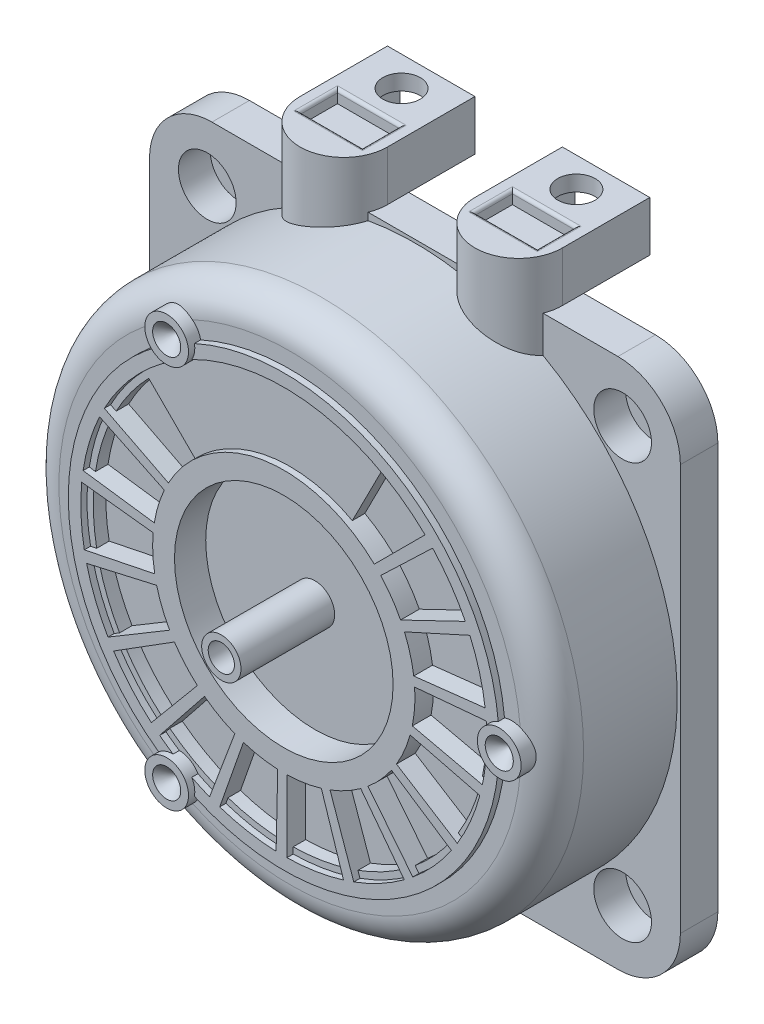
from build123d import *

# Parameters (mm, degrees)
SKETCH_1_W            = 85
SKETCH_1_H            = 85
EXTRUDE_1_DEPTH       = 6
FILLET_1_R            = 10
SKETCH_2_R            = 42
EXTRUDE_2_DEPTH       = 20
FILLET_2_R            = 5
CUT_EXTRUDE_1_DEPTH   = 2
EXTRUDE_START         = 1
SKETCH_4_R            = 34.5
EXTRUDE_3_DEPTH       = 1
SKETCH_5_R            = 17.5
CUT_EXTRUDE_3_DEPTH   = 5
EXTRUDE_5_DEPTH       = 2
EXTRUDE_5_DEPTH_BACK  = 15
SKETCH_7_R            = 3.5
SKETCH_8_R            = 2.25
CUT_EXTRUDE_4_DEPTH   = 2
CHAMFER_1_SIZE        = 2
EXTRUDE_6_DEPTH       = 8
EXTRUDE_7_REACH       = 125.426
EXTRUDE_7_END_RADIUS  = 42
SKETCH_13_W           = 10
SKETCH_13_H           = 5.5
CUT_EXTRUDE_6_DEPTH   = 14
SKETCH_14_W           = 10
SKETCH_14_H           = 6
CUT_EXTRUDE_7_DEPTH   = 2
FILLET_3_R            = 0.5
SKETCH_15_R           = 3
CUT_EXTRUDE_8_DEPTH   = 11
HOLE_WIZARD_M51_D     = 4.2
HOLE_WIZARD_M51_DEPTH = 38.5
HOLE_WIZARD_M51_TIP   = 1.2618073
SKETCH_9_R            = 3.15
EXTRUDE_8_DEPTH       = 15
HOLE_WIZARD_M52_D     = 4.2
HOLE_WIZARD_M52_DEPTH = 14
HOLE_WIZARD_M52_TIP   = 1.2618073
SKETCH_22_R           = 4.618802154
SKETCH_22_R_2         = 4.62
CUT_EXTRUDE_9_DEPTH   = 5.1


with BuildPart() as part:
    # Эскиз1 → Бобышка-Вытянуть1 (new body)
    with BuildSketch(Plane.XY):
        with Locations((42.5, 42.5)):
            Rectangle(SKETCH_1_W, SKETCH_1_H)
    extrude(amount=EXTRUDE_1_DEPTH)

    # Скругление1
    fillet_1_edges = [part.edges().sort_by_distance(p)[0] for p in [
        (0, 85, 3),
        (85, 85, 3),
        (85, 0, 3),
        (0, 0, 3),
    ]]
    fillet(fillet_1_edges, radius=FILLET_1_R)

    # Эскиз2 → Бобышка-Вытянуть2 (add)
    with BuildSketch(Plane.XY.offset(6)):
        with Locations((42.5, 42.5)):
            Circle(SKETCH_2_R)
    extrude(amount=EXTRUDE_2_DEPTH)

    # Скругление2
    fillet_2_edges = [part.edges().sort_by_distance(p)[0] for p in [
        (0.5, 42.5, 26),
    ]]
    fillet(fillet_2_edges, radius=FILLET_2_R)

    # Эскиз3 → Вырез-Вытянуть1 (cut)
    with BuildSketch(Plane.XY.offset(26)):
        with BuildLine():
            Line((61.198040686, 52.059459948), (70.660001971, 56.616100347))
            ThreePointArc((70.660001971, 56.616100347), (68.393065377, 60.438761535), (65.610701121, 63.904333526))
            Line((65.610701121, 63.904333526), (58.019920505, 56.646804146))
            ThreePointArc((58.019920505, 56.646804146), (59.762043584, 54.459174357), (61.198040686, 52.059459948))
        make_face()
        with BuildLine():
            Line((56.991479449, 57.69858623), (64.417504061, 65.124610842))
            ThreePointArc((64.417504061, 65.124610842), (61.015235447, 67.984035323), (57.244402341, 70.336174299))
            Line((57.244402341, 70.336174299), (52.476601049, 60.978837396))
            ThreePointArc((52.476601049, 60.978837396), (54.843490298, 59.489356882), (56.991479449, 57.69858623))
        make_face()
        with BuildLine():
            Line((63.306058378, 45.347443553), (73.742008823, 46.523292771))
            ThreePointArc((73.742008823, 46.523292771), (72.864830112, 50.880160635), (71.383208738, 55.070212925))
            Line((71.383208738, 55.070212925), (61.821387455, 50.727027824))
            ThreePointArc((61.821387455, 50.727027824), (62.743220075, 48.086773757), (63.306058378, 45.347443553))
        make_face()
        with BuildLine():
            Line((63.078942658, 38.31584906), (73.317620695, 35.978937612))
            ThreePointArc((73.317620695, 35.978937612), (73.928648564, 40.381026323), (73.914057387, 44.82529535))
            Line((73.914057387, 44.82529535), (63.45435057, 43.883904697))
            ThreePointArc((63.45435057, 43.883904697), (63.452432376, 41.087350882), (63.078942658, 38.31584906))
        make_face()
        with BuildLine():
            Line((60.542183483, 31.753855799), (69.434468086, 26.166463061))
            ThreePointArc((69.434468086, 26.166463061), (71.465124835, 30.119711503), (72.919201472, 34.319402112))
            Line((72.919201472, 34.319402112), (62.735536945, 36.885461324))
            ThreePointArc((62.735536945, 36.885461324), (61.810083224, 34.246474335), (60.542183483, 31.753855799))
        make_face()
        with BuildLine():
            Line((55.980489805, 26.397938188), (62.528370178, 18.187155905))
            ThreePointArc((62.528370178, 18.187155905), (65.750748421, 21.247877803), (68.510296994, 24.731644694))
            Line((68.510296994, 24.731644694), (59.745621435, 30.517156376))
            ThreePointArc((59.745621435, 30.517156376), (58.000498947, 28.331918535), (55.980489805, 26.397938188))
        make_face()
        with BuildLine():
            Line((49.905835741, 22.849208744), (53.374421403, 12.936560431))
            ThreePointArc((53.374421403, 12.936560431), (57.426862868, 14.761240747), (61.182170026, 17.138089127))
            Line((61.182170026, 17.138089127), (54.820172242, 25.493725983))
            ThreePointArc((54.820172242, 25.493725983), (52.451241912, 24.007493831), (49.905835741, 22.849208744))
        make_face()
        with BuildLine():
            Line((43, 21.505953225), (43, 11.003968504))
            ThreePointArc((43, 11.003968504), (47.427685649, 11.387817271), (51.75728073, 12.390985511))
            Line((51.75728073, 12.390985511), (48.511988976, 22.378966514))
            ThreePointArc((48.511988976, 22.378966514), (45.785123766, 21.758544847), (43, 21.505953225))
        make_face()
        with BuildLine():
            Line((36.03804759, 22.518929682), (32.569461927, 12.606281369))
            ThreePointArc((32.569461927, 12.606281369), (36.875457814, 11.506217959), (41.293415903, 11.023117136))
            Line((41.293415903, 11.023117136), (41.529060111, 21.522457824))
            ThreePointArc((41.529060111, 21.522457824), (38.750305209, 21.837478639), (36.03804759, 22.518929682))
        make_face()
        with BuildLine():
            Line((29.801341677, 25.774448386), (23.253461304, 17.563666103))
            ThreePointArc((23.253461304, 17.563666103), (26.954491131, 15.103154306), (30.964970039, 13.188004439))
            Line((30.964970039, 13.188004439), (34.655103072, 23.020328745))
            ThreePointArc((34.655103072, 23.020328745), (32.136327421, 24.235436204), (29.801341677, 25.774448386))
        make_face()
        with BuildLine():
            Line((24.989848594, 30.9071316), (16.097563991, 25.319738862))
            ThreePointArc((16.097563991, 25.319738862), (18.778248821, 21.774930133), (21.931139107, 18.642674887))
            Line((21.931139107, 18.642674887), (28.661605013, 26.704468221))
            ThreePointArc((28.661605013, 26.704468221), (26.685499214, 28.683286755), (24.989848594, 30.9071316))
        make_face()
        with BuildLine():
            Line((22.143578276, 37.340921148), (11.904900239, 35.004009699))
            ThreePointArc((11.904900239, 35.004009699), (13.264377862, 30.77274976), (15.20582012, 26.774932601))
            Line((15.20582012, 26.774932601), (24.221236234, 32.161392976))
            ThreePointArc((24.221236234, 32.161392976), (23.009585241, 34.681833174), (22.143578276, 37.340921148))
        make_face()
        with BuildLine():
            Line((21.581977146, 44.353731344), (11.146026701, 45.529580561))
            ThreePointArc((11.146026701, 45.529580561), (11.031718404, 41.086757844), (11.543818087, 36.672067142))
            Line((11.543818087, 36.672067142), (21.832354153, 38.778654122))
            ThreePointArc((21.832354153, 38.778654122), (21.521145603, 41.557838563), (21.581977146, 44.353731344))
        make_face()
        with BuildLine():
            Line((23.368075575, 51.15849108), (13.90611429, 55.715131479))
            ThreePointArc((13.90611429, 55.715131479), (12.330849274, 51.559378814), (11.356131725, 47.223290049))
            Line((11.356131725, 47.223290049), (21.763070982, 45.813574342))
            ThreePointArc((21.763070982, 45.813574342), (22.38723285, 48.539585876), (23.368075575, 51.15849108))
        make_face()
        with BuildLine():
            Line((27.30141377, 56.991479449), (19.875389158, 64.417504061))
            ThreePointArc((19.875389158, 64.417504061), (17.015964677, 61.015235447), (14.663825701, 57.244402341))
            Line((14.663825701, 57.244402341), (24.021162604, 52.476601049))
            ThreePointArc((24.021162604, 52.476601049), (25.510643118, 54.843490298), (27.30141377, 56.991479449))
        make_face()
    extrude(amount=-CUT_EXTRUDE_1_DEPTH, mode=Mode.SUBTRACT)

    # Эскиз4 → Бобышка-Вытянуть3 (add)
    with BuildSketch(Plane.XY.offset(26).offset(EXTRUDE_START)):
        with Locations((42.5, 42.5)):
            Circle(SKETCH_4_R)
        with BuildLine():
            Line((13.772710365, 57.698448283), (24.021162604, 52.476601049))
            ThreePointArc((24.021162604, 52.476601049), (39.214876234, 63.241455152), (56.991479449, 57.69858623))
            Line((56.991479449, 57.69858623), (65.124697196, 65.831803977))
            ThreePointArc((65.124697196, 65.831803977), (37.415879886, 74.599871069), (13.772710365, 57.698448283))
        make_face(mode=Mode.SUBTRACT)
        with BuildLine():
            Line((23.368075575, 51.15849108), (13.005035394, 56.149068205))
            ThreePointArc((13.005035394, 56.149068205), (11.373098458, 51.846978142), (10.365060946, 47.357539708))
            Line((10.365060946, 47.357539708), (21.763070982, 45.813574342))
            ThreePointArc((21.763070982, 45.813574342), (22.38723285, 48.539585876), (23.368075575, 51.15849108))
        make_face(mode=Mode.SUBTRACT)
        with BuildLine():
            Line((61.198040686, 52.059459948), (71.561080867, 57.050037073))
            ThreePointArc((71.561080867, 57.050037073), (69.215067452, 61.008246028), (66.333584254, 64.59548057))
            Line((66.333584254, 64.59548057), (58.019920505, 56.646804146))
            ThreePointArc((58.019920505, 56.646804146), (59.762043584, 54.459174357), (61.198040686, 52.059459948))
        make_face(mode=Mode.SUBTRACT)
        with BuildLine():
            Line((60.542183483, 31.753855799), (70.281295689, 25.634366011))
            ThreePointArc((70.281295689, 25.634366011), (72.384652608, 29.726686471), (73.889009413, 34.075031867))
            Line((73.889009413, 34.075031867), (62.735536945, 36.885461324))
            ThreePointArc((62.735536945, 36.885461324), (61.810083224, 34.246474335), (60.542183483, 31.753855799))
        make_face(mode=Mode.SUBTRACT)
        with BuildLine():
            Line((63.306058378, 45.347443553), (74.735842387, 46.63527092))
            ThreePointArc((74.735842387, 46.63527092), (73.828792973, 51.146197481), (72.293797475, 55.483821934))
            Line((72.293797475, 55.483821934), (61.821387455, 50.727027824))
            ThreePointArc((61.821387455, 50.727027824), (62.743220075, 48.086773757), (63.306058378, 45.347443553))
        make_face(mode=Mode.SUBTRACT)
        with BuildLine():
            Line((63.078942658, 38.31584906), (74.292667668, 35.756389503))
            ThreePointArc((74.292667668, 35.756389503), (74.926383439, 40.313757318), (74.910153312, 44.914945605))
            Line((74.910153312, 44.914945605), (63.45435057, 43.883904697))
            ThreePointArc((63.45435057, 43.883904697), (63.452432376, 41.087350882), (63.078942658, 38.31584906))
        make_face(mode=Mode.SUBTRACT)
        with BuildLine():
            Line((55.980489805, 26.397938188), (63.151936122, 17.405228943))
            ThreePointArc((63.151936122, 17.405228943), (66.488867418, 20.573207257), (69.344972168, 24.180680436))
            Line((69.344972168, 24.180680436), (59.745621435, 30.517156376))
            ThreePointArc((59.745621435, 30.517156376), (58.000498947, 28.331918535), (55.980489805, 26.397938188))
        make_face(mode=Mode.SUBTRACT)
        with BuildLine():
            Line((43, 21.505953225), (43, 10.003846381))
            ThreePointArc((43, 10.003846381), (47.584120114, 10.400128931), (52.066335462, 11.439812849))
            Line((52.066335462, 11.439812849), (48.511988976, 22.378966514))
            ThreePointArc((48.511988976, 22.378966514), (45.785123766, 21.758544847), (43, 21.505953225))
        make_face(mode=Mode.SUBTRACT)
        with BuildLine():
            Line((49.905835741, 22.849208744), (53.704740799, 11.992561831))
            ThreePointArc((53.704740799, 11.992561831), (57.90073153, 13.880645215), (61.788034051, 16.342367415))
            Line((61.788034051, 16.342367415), (54.820172242, 25.493725983))
            ThreePointArc((54.820172242, 25.493725983), (52.451241912, 24.007493831), (49.905835741, 22.849208744))
        make_face(mode=Mode.SUBTRACT)
        with BuildLine():
            Line((36.03804759, 22.518929682), (32.239142531, 11.662282769))
            ThreePointArc((32.239142531, 11.662282769), (36.696900919, 10.522288371), (41.270975098, 10.02324681))
            Line((41.270975098, 10.02324681), (41.529060111, 21.522457824))
            ThreePointArc((41.529060111, 21.522457824), (38.750305209, 21.837478639), (36.03804759, 22.518929682))
        make_face(mode=Mode.SUBTRACT)
        with BuildLine():
            Line((29.801341677, 25.774448386), (22.62989536, 16.781739141))
            ThreePointArc((22.62989536, 16.781739141), (26.460982913, 14.233413172), (30.613552304, 12.251655233))
            Line((30.613552304, 12.251655233), (34.655103072, 23.020328745))
            ThreePointArc((34.655103072, 23.020328745), (32.136327421, 24.235436204), (29.801341677, 25.774448386))
        make_face(mode=Mode.SUBTRACT)
        with BuildLine():
            Line((24.989848594, 30.9071316), (15.250736388, 24.787641812))
            ThreePointArc((15.250736388, 24.787641812), (18.025177355, 21.116991407), (21.290185227, 17.8749364))
            Line((21.290185227, 17.8749364), (28.661605013, 26.704468221))
            ThreePointArc((28.661605013, 26.704468221), (26.685499214, 28.683286755), (24.989848594, 30.9071316))
        make_face(mode=Mode.SUBTRACT)
        with BuildLine():
            Line((22.143578276, 37.340921148), (10.929853266, 34.781461591))
            ThreePointArc((10.929853266, 34.781461591), (12.336262873, 30.400456102), (14.347266491, 26.261970687))
            Line((14.347266491, 26.261970687), (24.221236234, 32.161392976))
            ThreePointArc((24.221236234, 32.161392976), (23.009585241, 34.681833174), (22.143578276, 37.340921148))
        make_face(mode=Mode.SUBTRACT)
        with BuildLine():
            Line((21.581977146, 44.353731344), (10.152193137, 45.64155871))
            ThreePointArc((10.152193137, 45.64155871), (10.032725337, 41.041893014), (10.564023049, 36.47145323))
            Line((10.564023049, 36.47145323), (21.832354153, 38.778654122))
            ThreePointArc((21.832354153, 38.778654122), (21.521145603, 41.557838563), (21.581977146, 44.353731344))
        make_face(mode=Mode.SUBTRACT)
    extrude(amount=-EXTRUDE_3_DEPTH)

    # Эскиз5 → Вырез-Вытянуть3 (cut)
    with BuildSketch(Plane.XY.offset(27)):
        with Locations((42.5, 42.5)):
            Circle(SKETCH_5_R)
    extrude(amount=-CUT_EXTRUDE_3_DEPTH, mode=Mode.SUBTRACT)

    # Эскиз7 → Бобышка-Вытянуть5 (add, two sides: drawn at the far end of the back side and taken through both)
    with BuildSketch(Plane.XY.offset(26).offset(-EXTRUDE_5_DEPTH_BACK)):
        with Locations((24.75, 73.243901834)):
            Circle(SKETCH_7_R)
        with Locations((78, 42.5)):
            Circle(SKETCH_7_R)
        with Locations((24.75, 11.756098166)):
            Circle(SKETCH_7_R)
    extrude(amount=EXTRUDE_5_DEPTH + EXTRUDE_5_DEPTH_BACK)

    # Эскиз8 → Вырез-Вытянуть4 (cut)
    with BuildSketch(Plane.XY.offset(28)):
        with Locations((24.75, 11.756098166)):
            Circle(SKETCH_8_R)
        with Locations((78, 42.5)):
            Circle(SKETCH_8_R)
        with Locations((24.75, 73.243901834)):
            Circle(SKETCH_8_R)
    extrude(amount=-CUT_EXTRUDE_4_DEPTH, mode=Mode.SUBTRACT)

    # Фаска1
    chamfer_1_edges = [part.edges().sort_by_distance(p)[0] for p in [
        (22.5, 11.756098166, 26),
        (75.75, 42.5, 26),
        (22.5, 73.243901834, 26),
    ]]
    chamfer(chamfer_1_edges, length=CHAMFER_1_SIZE - 0.0001)  # a hair under: the kernel refuses the full size

    # Эскиз11 → Бобышка-Вытянуть6 (add)
    with BuildSketch(Plane(origin=(0, 85, 0), x_dir=(1, 0, 0), z_dir=(0, 1, 0))):
        with BuildLine():
            Line((63.5, -3.4), (63.5, 10.6))
            Line((63.5, 10.6), (49.5, 10.6))
            Line((49.5, 10.6), (49.5, -3.4))
            ThreePointArc((49.5, -3.4), (56.5, -10.4), (63.5, -3.4))
        make_face()
        with BuildLine():
            Line((35.5, -3.4), (35.5, 10.6))
            Line((35.5, 10.6), (21.5, 10.6))
            Line((21.5, 10.6), (21.5, -3.4))
            ThreePointArc((21.5, -3.4), (28.5, -10.4), (35.5, -3.4))
        make_face()
    extrude(amount=EXTRUDE_6_DEPTH)

    # Бобышка-Вытянуть7: up to this cylinder (the profile starts outside it)
    extrude_7_end = Plane(origin=(42.5, 42.5, 6.370892), z_dir=(0, 0, -1)) * Cylinder(EXTRUDE_7_END_RADIUS, 335.852, mode=Mode.PRIVATE)
    # Эскиз12 → Бобышка-Вытянуть7 (add, up to the surface)
    with BuildSketch(Plane.XZ.offset(-85), mode=Mode.PRIVATE) as extrude_7_sk1:
        with BuildLine():
            Line((21.5, 3.4), (35.5, 3.4))
            ThreePointArc((35.5, 3.4), (28.5, 10.4), (21.5, 3.4))
        make_face()
    extrude_7_tool1 = extrude(extrude_7_sk1.sketch, amount=EXTRUDE_7_REACH, mode=Mode.PRIVATE) - extrude_7_end
    add(extrude_7_tool1.solids().sort_by_distance((28.5, 85, 6.370892))[0])
    # Эскиз12 → Бобышка-Вытянуть7 (add, up to the surface)
    with BuildSketch(Plane.XZ.offset(-85), mode=Mode.PRIVATE) as extrude_7_sk2:
        with BuildLine():
            Line((49.5, 3.4), (63.5, 3.4))
            ThreePointArc((63.5, 3.4), (56.5, 10.4), (49.5, 3.4))
        make_face()
    extrude_7_tool2 = extrude(extrude_7_sk2.sketch, amount=EXTRUDE_7_REACH, mode=Mode.PRIVATE) - extrude_7_end
    add(extrude_7_tool2.solids().sort_by_distance((56.5, 85, 6.370892))[0])

    # Эскиз13 → Вырез-Вытянуть6 (cut)
    with BuildSketch(Plane(origin=(0, 0, -10.6), x_dir=(-1, 0, 0), z_dir=(0, 0, -1))):
        with Locations((-56.5, 87.75)):
            Rectangle(SKETCH_13_W, SKETCH_13_H)
        with Locations((-28.5, 87.75)):
            Rectangle(SKETCH_13_W, SKETCH_13_H)
    extrude(amount=-CUT_EXTRUDE_6_DEPTH, mode=Mode.SUBTRACT)

    # Эскиз14 → Вырез-Вытянуть7 (cut)
    with BuildSketch(Plane(origin=(0, 93, 0), x_dir=(1, 0, 0), z_dir=(0, 1, 0))):
        with Locations((56.5, -2.4)):
            Rectangle(SKETCH_14_W, SKETCH_14_H)
        with Locations((28.5, -2.4)):
            Rectangle(SKETCH_14_W, SKETCH_14_H)
    extrude(amount=-CUT_EXTRUDE_7_DEPTH, mode=Mode.SUBTRACT)

    # Скругление3
    fillet_3_edges = [part.edges().sort_by_distance(p)[0] for p in [
        (56.5, 93, 5.4),
        (61.5, 93, 2.4),
        (56.5, 93, -0.6),
        (51.5, 93, 2.4),
        (23.5, 93, 2.4),
        (28.5, 93, 5.4),
        (33.5, 93, 2.4),
        (28.5, 93, -0.6),
    ]]
    fillet(fillet_3_edges, radius=FILLET_3_R)

    # Эскиз15 → Вырез-Вытянуть8 (cut)
    with BuildSketch(Plane(origin=(0, 93, 0), x_dir=(1, 0, 0), z_dir=(0, 1, 0))):
        with Locations(Location((28.5, 5.85, 0), (0, 0, 180))):
            Circle(SKETCH_15_R)
        with Locations(Location((56.5, 5.85, 0), (0, 0, 180))):
            Circle(SKETCH_15_R)
    extrude(amount=-CUT_EXTRUDE_8_DEPTH, mode=Mode.SUBTRACT)

    # Отверстие обработанное метчиком M51
    with Locations(Plane.XY.offset(6)):
        with Locations((9.25, 9.25), (9.25, 75.75), (75.75, 75.75), (75.75, 9.25)):
            Hole(HOLE_WIZARD_M51_D / 2, depth=HOLE_WIZARD_M51_DEPTH)
            with Locations((0, 0, -(HOLE_WIZARD_M51_DEPTH + HOLE_WIZARD_M51_TIP / 2))):  # 118° drill point
                Cone(0, HOLE_WIZARD_M51_D / 2, HOLE_WIZARD_M51_TIP, mode=Mode.SUBTRACT)

    # Эскиз9 → Бобышка-Вытянуть8 (add)
    with BuildSketch(Plane.XY.offset(22)):
        with Locations((42.5, 42.5)):
            Circle(SKETCH_9_R)
    extrude(amount=EXTRUDE_8_DEPTH)

    # Отверстие обработанное метчиком M52
    with Locations(Plane.XY.offset(37)):
        with Locations((42.5, 42.5)):
            Hole(HOLE_WIZARD_M52_D / 2, depth=HOLE_WIZARD_M52_DEPTH)
            with Locations((0, 0, -(HOLE_WIZARD_M52_DEPTH + HOLE_WIZARD_M52_TIP / 2))):  # 118° drill point
                Cone(0, HOLE_WIZARD_M52_D / 2, HOLE_WIZARD_M52_TIP, mode=Mode.SUBTRACT)

    # Эскиз22 → Вырез-Вытянуть9 (cut)
    with BuildSketch(Plane.XY.offset(6)):
        with Locations((75.75, 75.75)):
            Circle(SKETCH_22_R)
        with Locations((9.25, 75.75)):
            Circle(SKETCH_22_R_2)
        with Locations((9.25, 9.25)):
            Circle(SKETCH_22_R_2)
        with Locations((75.75, 9.25)):
            Circle(SKETCH_22_R_2)
    extrude(amount=-CUT_EXTRUDE_9_DEPTH, mode=Mode.SUBTRACT)


solid = part.part
